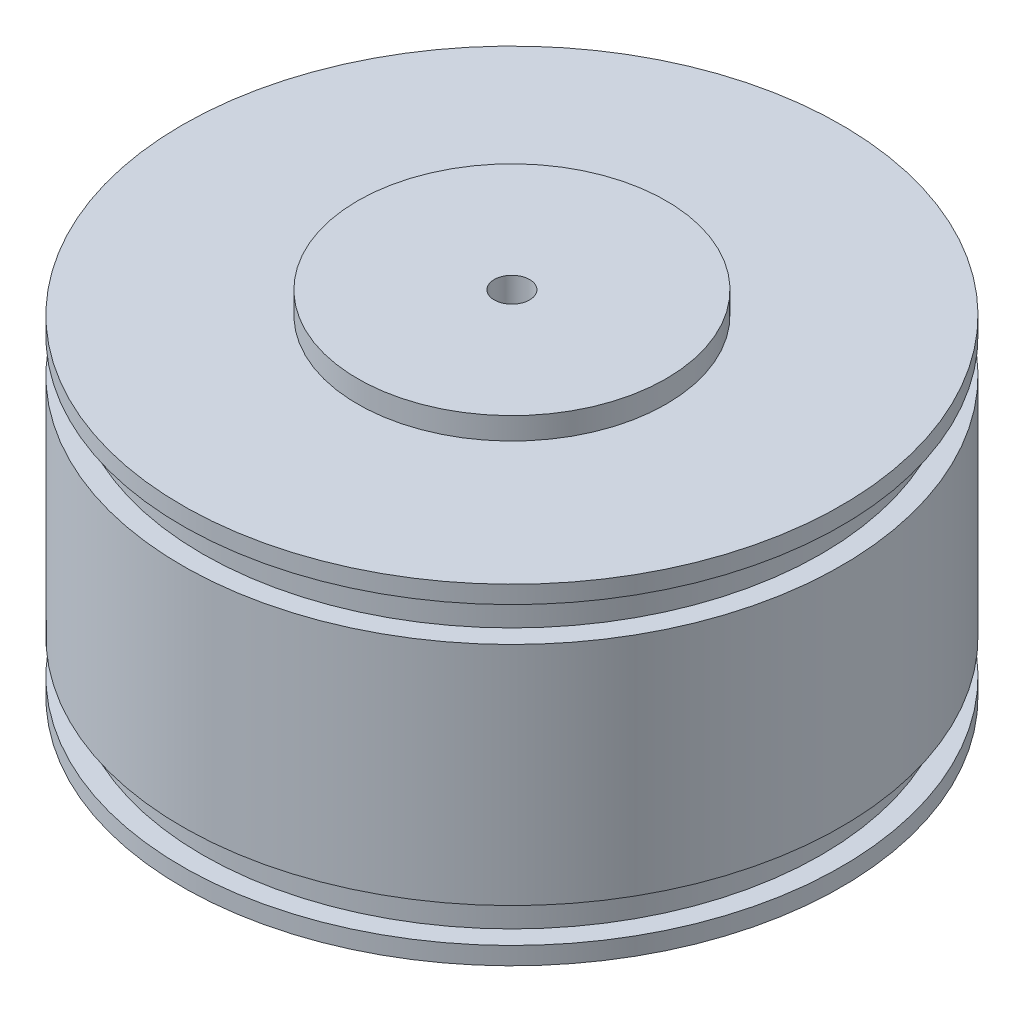
from build123d import *

# Parameters (mm, degrees)
F_1_4_20_TAPPED_HOLE1_D     = 5.1054
F_1_4_20_TAPPED_HOLE1_DEPTH = 8.118183098
F_1_4_20_TAPPED_HOLE1_TIP   = 1.533816902


with BuildPart() as part:
    # Sketch1 → Revolve1 (revolve)
    with BuildSketch(Plane.XY):
        Polygon((0, 0), (22.225, 0), (22.225, -3.175), (47.498, -3.175), (47.498, -5.715), (44.577, -5.715), (44.577, -10.6934), (47.498, -10.6934), (47.498, -28.7782), (47.498, -33.7566), (47.498, -43.2816), (44.577, -43.2816), (44.577, -48.26), (47.498, -48.26), (47.498, -50.8), (41.148, -50.8), (41.148, -12.7), (0, -12.7), align=None)
    revolve(axis=Axis((0, 38.901080227, 0), (0, -1, 0)))

    # 1/4-20 Tapped Hole1
    with Locations(Plane(origin=(0, 0, 0), x_dir=(1, 0, 0), z_dir=(0, 1, 0))):
        with Locations((0, 0)):
            Hole(F_1_4_20_TAPPED_HOLE1_D / 2, depth=F_1_4_20_TAPPED_HOLE1_DEPTH)
            with Locations((0, 0, -(F_1_4_20_TAPPED_HOLE1_DEPTH + F_1_4_20_TAPPED_HOLE1_TIP / 2))):  # 118° drill point
                Cone(0, F_1_4_20_TAPPED_HOLE1_D / 2, F_1_4_20_TAPPED_HOLE1_TIP, mode=Mode.SUBTRACT)


solid = part.part
